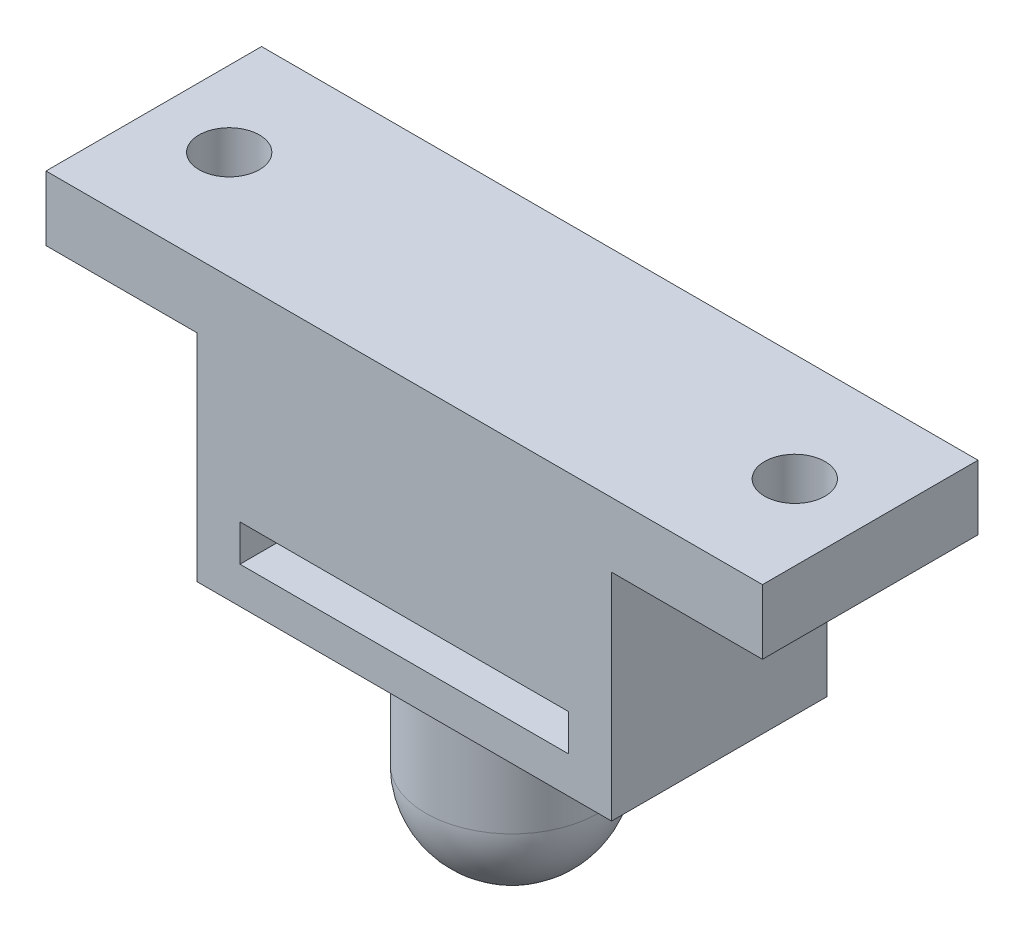
from build123d import *

# Parameters (mm, degrees)
SKETCH1_W             = 7
SKETCH1_H             = 10
BOSS_EXTRUDE1_DEPTH   = 3
BOSS_EXTRUDE1_2_DEPTH = 3
SKETCH1_4_W           = 19.24
SKETCH1_4_H           = 10
BOSS_EXTRUDE2_DEPTH   = 13
SKETCH2_W             = 15.24
SKETCH2_H             = 1.7
CUT_EXTRUDE1_DEPTH    = 14
SKETCH3_R             = 4
BOSS_EXTRUDE3_DEPTH   = 9
FILLET1_R             = 4
CUT_EXTRUDE2_REACH    = 30.022
SKETCH4_R             = 1.4
CUT_EXTRUDE3_REACH    = 32.022
CUT_EXTRUDE3_START    = -2
SKETCH4_3_R           = 1.4


with BuildPart() as part:
    # Sketch1 → Boss-Extrude1 (new body)
    with BuildSketch(Plane(origin=(0, 0, 0), x_dir=(1, 0, 0), z_dir=(0, 1, 0))):
        with Locations((-13.12, 0)):
            Rectangle(SKETCH1_W, SKETCH1_H)
    extrude(amount=-BOSS_EXTRUDE1_DEPTH)



with BuildPart() as body_2:
    # Sketch1 → Boss-Extrude1 2 (new body)
    with BuildSketch(Plane(origin=(0, 0, 0), x_dir=(1, 0, 0), z_dir=(0, 1, 0))):
        with Locations((13.12, 0)):
            Rectangle(SKETCH1_W, SKETCH1_H)
    extrude(amount=-BOSS_EXTRUDE1_2_DEPTH)


with BuildPart() as part_1:
    add(part.part)

    add(body_2.part)  # Boss-Extrude2 merges body 2
    # Sketch1<4> → Boss-Extrude2 (add)
    with BuildSketch(Plane(origin=(0, 0, 0), x_dir=(1, 0, 0), z_dir=(0, 1, 0))):
        Rectangle(SKETCH1_4_W, SKETCH1_4_H)
    extrude(amount=-BOSS_EXTRUDE2_DEPTH)

    # Sketch2 → Cut-Extrude1 (cut)
    with BuildSketch(Plane.XY.offset(5)):
        with Locations((0, -10.45)):
            Rectangle(SKETCH2_W, SKETCH2_H)
    extrude(amount=-CUT_EXTRUDE1_DEPTH, mode=Mode.SUBTRACT)

    # Sketch3 → Boss-Extrude3 (add)
    with BuildSketch(Plane.XZ.offset(13)):
        Circle(SKETCH3_R)
    extrude(amount=BOSS_EXTRUDE3_DEPTH)

    # Fillet1
    fillet1_edges = [part_1.edges().sort_by_distance(p)[0] for p in [
        (-4, -22, 0),
    ]]
    fillet(fillet1_edges, radius=FILLET1_R)

    # Sketch4 → Cut-Extrude2 (cut, up to next)
    with BuildSketch(Plane(origin=(0, 0, 0), x_dir=(1, 0, 0), z_dir=(0, 1, 0)), mode=Mode.PRIVATE) as cut_extrude2_sk1:
        with Locations((-13.12, 0)):
            Circle(SKETCH4_R)
    cut_extrude2_tool1 = extrude(cut_extrude2_sk1.sketch, amount=-CUT_EXTRUDE2_REACH, mode=Mode.PRIVATE) & part_1.part
    # Sketch4 → Cut-Extrude2 (cut, up to next)
    with BuildSketch(Plane(origin=(0, 0, 0), x_dir=(1, 0, 0), z_dir=(0, 1, 0)), mode=Mode.PRIVATE) as cut_extrude2_sk2:
        with Locations((13.12, 0)):
            Circle(SKETCH4_R)
    cut_extrude2_tool2 = extrude(cut_extrude2_sk2.sketch, amount=-CUT_EXTRUDE2_REACH, mode=Mode.PRIVATE) & part_1.part
    add(cut_extrude2_tool1.solids().sort_by_distance((-13.12, 0, 0))[0], mode=Mode.SUBTRACT)
    add(cut_extrude2_tool2.solids().sort_by_distance((13.12, 0, 0))[0], mode=Mode.SUBTRACT)

    # Sketch4<3> → Cut-Extrude3 (cut, up to next)
    with BuildSketch(Plane(origin=(0, 0, 0), x_dir=(1, 0, 0), z_dir=(0, 1, 0)).offset(CUT_EXTRUDE3_START), mode=Mode.PRIVATE) as cut_extrude3_sk1:
        Polygon((-15.62, 1.443375673), (-15.62, -1.443375673), (-13.12, -2.886751346), (-10.62, -1.443375673), (-10.62, 1.443375673), (-13.12, 2.886751346), align=None)
        with Locations((-13.12, 0)):
            Circle(SKETCH4_3_R, mode=Mode.SUBTRACT)
    cut_extrude3_tool1 = extrude(cut_extrude3_sk1.sketch, amount=-CUT_EXTRUDE3_REACH, mode=Mode.PRIVATE) & part_1.part
    # Sketch4<3> → Cut-Extrude3 (cut, up to next)
    with BuildSketch(Plane(origin=(0, 0, 0), x_dir=(1, 0, 0), z_dir=(0, 1, 0)).offset(CUT_EXTRUDE3_START), mode=Mode.PRIVATE) as cut_extrude3_sk2:
        Polygon((10.62, 1.443375673), (10.62, -1.443375673), (13.12, -2.886751346), (15.62, -1.443375673), (15.62, 1.443375673), (13.12, 2.886751346), align=None)
        with Locations((13.12, 0)):
            Circle(SKETCH4_3_R, mode=Mode.SUBTRACT)
    cut_extrude3_tool2 = extrude(cut_extrude3_sk2.sketch, amount=-CUT_EXTRUDE3_REACH, mode=Mode.PRIVATE) & part_1.part
    add(cut_extrude3_tool1.solids().sort_by_distance((-15.543624, -2, 0))[0], mode=Mode.SUBTRACT)
    add(cut_extrude3_tool2.solids().sort_by_distance((10.696376, -2, 0))[0], mode=Mode.SUBTRACT)


solid = part_1.part
